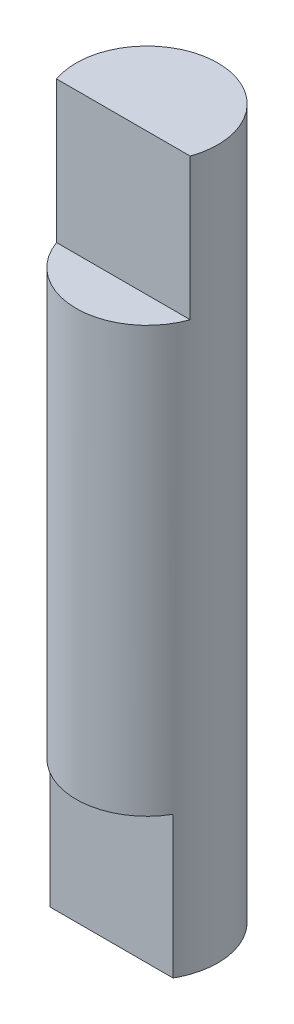
from build123d import *

# Parameters (mm, degrees)
CROQUIS1_R                 = 3
SALIENTE_EXTRUIR1_DEPTH    = 15
CORTAR_EXTRUIR2_DEPTH      = 31.298514815
CORTAR_EXTRUIR2_DEPTH_BACK = 6
CROQUIS3_W                 = 8.224241852
CROQUIS3_H                 = 2
CORTAR_EXTRUIR3_START      = -6
CORTAR_EXTRUIR3_DEPTH      = 6


with BuildPart() as part:
    # Croquis1 → Saliente-Extruir1 (new, symmetric)
    with BuildSketch(Plane(origin=(0, 0, 0), x_dir=(1, 0, 0), z_dir=(0, 1, 0))):
        Circle(CROQUIS1_R)
    extrude(amount=SALIENTE_EXTRUIR1_DEPTH, both=True)

    # Croquis3 → Cortar-Extruir2 (cut, two sides: drawn at the far end of the back side and taken through both)
    with BuildSketch(Plane(origin=(0, 15, 0), x_dir=(1, 0, 0), z_dir=(0, 1, 0)).offset(-CORTAR_EXTRUIR2_DEPTH_BACK)):
        with Locations((0.237694851, -2)):
            Rectangle(CROQUIS3_W, CROQUIS3_H)
    extrude(amount=CORTAR_EXTRUIR2_DEPTH + CORTAR_EXTRUIR2_DEPTH_BACK, mode=Mode.SUBTRACT)

    # Croquis7 → Cortar-Extruir3 (cut)
    with BuildSketch(Plane.XZ.offset(15).offset(CORTAR_EXTRUIR3_START)):
        with BuildLine():
            Line((-2.598076211, 1.5), (2.598076211, 1.5))
            ThreePointArc((2.598076211, 1.5), (0, 3), (-2.598076211, 1.5))
        make_face()
    extrude(amount=CORTAR_EXTRUIR3_DEPTH, mode=Mode.SUBTRACT)


solid = part.part
